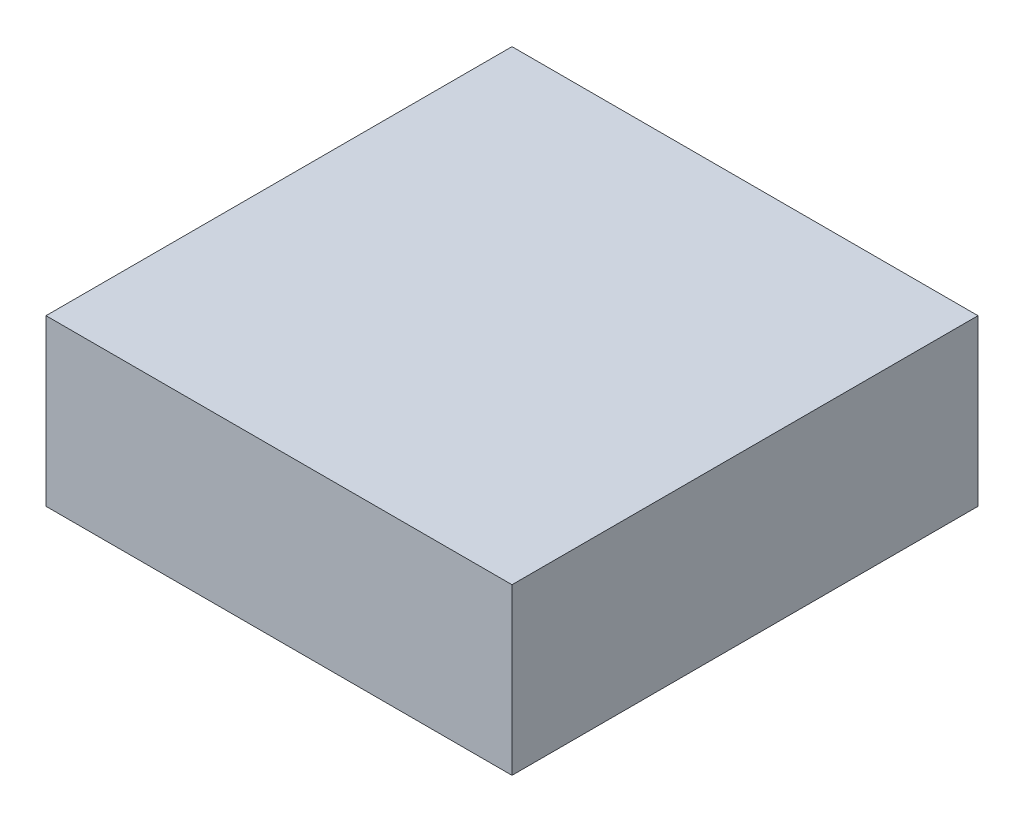
from build123d import *

# Parameters (mm, degrees)
SKETCH1_W           = 127
SKETCH1_H           = 127
BOSS_EXTRUDE1_DEPTH = 45


with BuildPart() as part:
    # Sketch1 → Boss-Extrude1 (new body)
    with BuildSketch(Plane(origin=(0, 0, 0), x_dir=(1, 0, 0), z_dir=(0, 1, 0))):
        with Locations((63.5, 63.5)):
            Rectangle(SKETCH1_W, SKETCH1_H)
    extrude(amount=BOSS_EXTRUDE1_DEPTH)


solid = part.part
